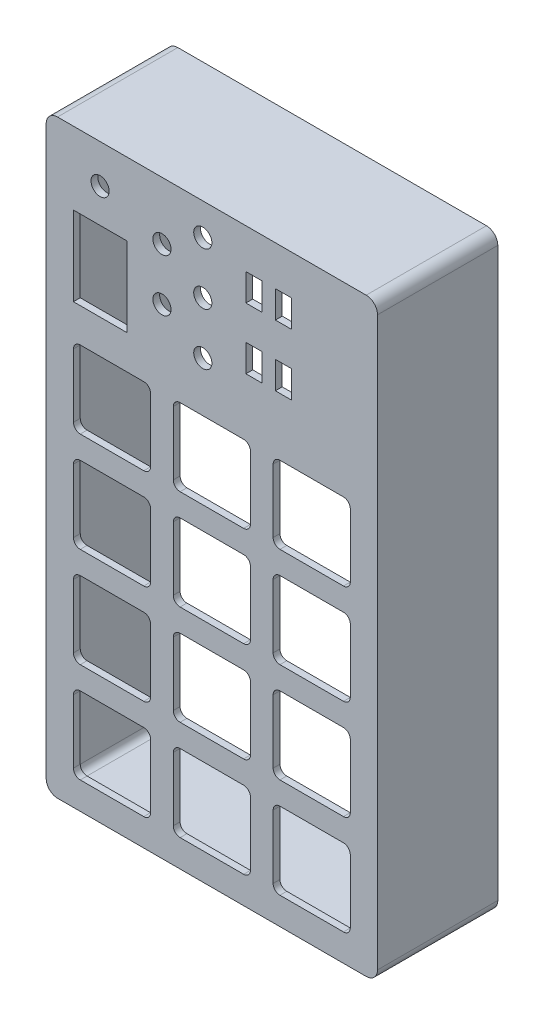
from build123d import *

# Parameters (mm, degrees)
CROQUIS1_W              = 12
CROQUIS1_H              = 7
CROQUIS1_R              = 4
CROQUIS1_W_2            = 35
CROQUIS1_H_2            = 23.5
SALIENTE_EXTRUIR1_DEPTH = 3
SALIENTE_EXTRUIR2_START = -50
SALIENTE_EXTRUIR2_DEPTH = 50


with BuildPart() as part:
    # Croquis1 → Saliente-Extruir1 (new body)
    with BuildSketch(Plane(origin=(0, 0, 0), x_dir=(0, 1, 0), z_dir=(0, 0, 1))):
        with BuildLine():
            Line((-188, 68), (-188, -68))
            ThreePointArc((-188, -68), (-186.535533906, -71.535533906), (-183, -73))
            Line((-183, -73), (67, -73))
            ThreePointArc((67, -73), (70.535533906, -71.535533906), (72, -68))
            Line((72, -68), (72, 68))
            ThreePointArc((72, 68), (70.535533906, 71.535533906), (67, 73))
            Line((67, 73), (-183, 73))
            ThreePointArc((-183, 73), (-186.535533906, 71.535533906), (-188, 68))
        make_face()
        with BuildLine():
            Line((-176, -58), (-176, -30))
            ThreePointArc((-176, -30), (-175.121320344, -27.878679656), (-173, -27))
            Line((-173, -27), (-145, -27))
            ThreePointArc((-145, -27), (-142.878679656, -27.878679656), (-142, -30))
            Line((-142, -30), (-142, -58))
            ThreePointArc((-142, -58), (-142.878679656, -60.121320344), (-145, -61))
            Line((-145, -61), (-173, -61))
            ThreePointArc((-173, -61), (-175.121320344, -60.121320344), (-176, -58))
        make_face(mode=Mode.SUBTRACT)
        with BuildLine():
            Line((-132, -58), (-132, -30))
            ThreePointArc((-132, -30), (-131.121320344, -27.878679656), (-129, -27))
            Line((-129, -27), (-101, -27))
            ThreePointArc((-101, -27), (-98.878679656, -27.878679656), (-98, -30))
            Line((-98, -30), (-98, -58))
            ThreePointArc((-98, -58), (-98.878679656, -60.121320344), (-101, -61))
            Line((-101, -61), (-129, -61))
            ThreePointArc((-129, -61), (-131.121320344, -60.121320344), (-132, -58))
        make_face(mode=Mode.SUBTRACT)
        with BuildLine():
            Line((-88, -58), (-88, -30))
            ThreePointArc((-88, -30), (-87.121320344, -27.878679656), (-85, -27))
            Line((-85, -27), (-57, -27))
            ThreePointArc((-57, -27), (-54.878679656, -27.878679656), (-54, -30))
            Line((-54, -30), (-54, -58))
            ThreePointArc((-54, -58), (-54.878679656, -60.121320344), (-57, -61))
            Line((-57, -61), (-85, -61))
            ThreePointArc((-85, -61), (-87.121320344, -60.121320344), (-88, -58))
        make_face(mode=Mode.SUBTRACT)
        with BuildLine():
            Line((-44, -58), (-44, -30))
            ThreePointArc((-44, -30), (-43.121320344, -27.878679656), (-41, -27))
            Line((-41, -27), (-13, -27))
            ThreePointArc((-13, -27), (-10.878679656, -27.878679656), (-10, -30))
            Line((-10, -30), (-10, -58))
            ThreePointArc((-10, -58), (-10.878679656, -60.121320344), (-13, -61))
            Line((-13, -61), (-41, -61))
            ThreePointArc((-41, -61), (-43.121320344, -60.121320344), (-44, -58))
        make_face(mode=Mode.SUBTRACT)
        with Locations((21.5, -31.5)):
            Rectangle(CROQUIS1_W, CROQUIS1_H, mode=Mode.SUBTRACT)
        with Locations((21.5, -18.5)):
            Rectangle(CROQUIS1_W, CROQUIS1_H, mode=Mode.SUBTRACT)
        with Locations((48.5, -31.5)):
            Rectangle(CROQUIS1_W, CROQUIS1_H, mode=Mode.SUBTRACT)
        with Locations((48.5, -18.5)):
            Rectangle(CROQUIS1_W, CROQUIS1_H, mode=Mode.SUBTRACT)
        with BuildLine():
            Line((-176, -14), (-176, 14))
            ThreePointArc((-176, 14), (-175.121320344, 16.121320344), (-173, 17))
            Line((-173, 17), (-145, 17))
            ThreePointArc((-145, 17), (-142.878679656, 16.121320344), (-142, 14))
            Line((-142, 14), (-142, -14))
            ThreePointArc((-142, -14), (-142.878679656, -16.121320344), (-145, -17))
            Line((-145, -17), (-173, -17))
            ThreePointArc((-173, -17), (-175.121320344, -16.121320344), (-176, -14))
        make_face(mode=Mode.SUBTRACT)
        with BuildLine():
            Line((-132, -14), (-132, 14))
            ThreePointArc((-132, 14), (-131.121320344, 16.121320344), (-129, 17))
            Line((-129, 17), (-101, 17))
            ThreePointArc((-101, 17), (-98.878679656, 16.121320344), (-98, 14))
            Line((-98, 14), (-98, -14))
            ThreePointArc((-98, -14), (-98.878679656, -16.121320344), (-101, -17))
            Line((-101, -17), (-129, -17))
            ThreePointArc((-129, -17), (-131.121320344, -16.121320344), (-132, -14))
        make_face(mode=Mode.SUBTRACT)
        with BuildLine():
            Line((-88, -14), (-88, 14))
            ThreePointArc((-88, 14), (-87.121320344, 16.121320344), (-85, 17))
            Line((-85, 17), (-57, 17))
            ThreePointArc((-57, 17), (-54.878679656, 16.121320344), (-54, 14))
            Line((-54, 14), (-54, -14))
            ThreePointArc((-54, -14), (-54.878679656, -16.121320344), (-57, -17))
            Line((-57, -17), (-85, -17))
            ThreePointArc((-85, -17), (-87.121320344, -16.121320344), (-88, -14))
        make_face(mode=Mode.SUBTRACT)
        with BuildLine():
            ThreePointArc((-176, 58), (-175.121320344, 60.121320344), (-173, 61))
            Line((-173, 61), (-145, 61))
            ThreePointArc((-145, 61), (-142.878679656, 60.121320344), (-142, 58))
            Line((-142, 58), (-142, 30))
            ThreePointArc((-142, 30), (-142.878679656, 27.878679656), (-145, 27))
            Line((-145, 27), (-173, 27))
            ThreePointArc((-173, 27), (-175.121320344, 27.878679656), (-176, 30))
            Line((-176, 30), (-176, 58))
        make_face(mode=Mode.SUBTRACT)
        with BuildLine():
            Line((-132, 30), (-132, 58))
            ThreePointArc((-132, 58), (-131.121320344, 60.121320344), (-129, 61))
            Line((-129, 61), (-101, 61))
            ThreePointArc((-101, 61), (-98.878679656, 60.121320344), (-98, 58))
            Line((-98, 58), (-98, 30))
            ThreePointArc((-98, 30), (-98.878679656, 27.878679656), (-101, 27))
            Line((-101, 27), (-129, 27))
            ThreePointArc((-129, 27), (-131.121320344, 27.878679656), (-132, 30))
        make_face(mode=Mode.SUBTRACT)
        with BuildLine():
            Line((-88, 30), (-88, 58))
            ThreePointArc((-88, 58), (-87.121320344, 60.121320344), (-85, 61))
            Line((-85, 61), (-57, 61))
            ThreePointArc((-57, 61), (-54.878679656, 60.121320344), (-54, 58))
            Line((-54, 58), (-54, 30))
            ThreePointArc((-54, 30), (-54.878679656, 27.878679656), (-57, 27))
            Line((-57, 27), (-85, 27))
            ThreePointArc((-85, 27), (-87.121320344, 27.878679656), (-88, 30))
        make_face(mode=Mode.SUBTRACT)
        with BuildLine():
            Line((-44, -14), (-44, 14))
            ThreePointArc((-44, 14), (-43.121320344, 16.121320344), (-41, 17))
            Line((-41, 17), (-13, 17))
            ThreePointArc((-13, 17), (-10.878679656, 16.121320344), (-10, 14))
            Line((-10, 14), (-10, -14))
            ThreePointArc((-10, -14), (-10.878679656, -16.121320344), (-13, -17))
            Line((-13, -17), (-41, -17))
            ThreePointArc((-41, -17), (-43.121320344, -16.121320344), (-44, -14))
        make_face(mode=Mode.SUBTRACT)
        with Locations((12, 4)):
            Circle(CROQUIS1_R, mode=Mode.SUBTRACT)
        with Locations((35, 4)):
            Circle(CROQUIS1_R, mode=Mode.SUBTRACT)
        with Locations((58, 4)):
            Circle(CROQUIS1_R, mode=Mode.SUBTRACT)
        with Locations((23.5, 22)):
            Circle(CROQUIS1_R, mode=Mode.SUBTRACT)
        with Locations((46.5, 22)):
            Circle(CROQUIS1_R, mode=Mode.SUBTRACT)
        with BuildLine():
            Line((-44, 30), (-44, 58))
            ThreePointArc((-44, 58), (-43.121320344, 60.121320344), (-41, 61))
            Line((-41, 61), (-13, 61))
            ThreePointArc((-13, 61), (-10.878679656, 60.121320344), (-10, 58))
            Line((-10, 58), (-10, 30))
            ThreePointArc((-10, 30), (-10.878679656, 27.878679656), (-13, 27))
            Line((-13, 27), (-41, 27))
            ThreePointArc((-41, 27), (-43.121320344, 27.878679656), (-44, 30))
        make_face(mode=Mode.SUBTRACT)
        with Locations((22.5, 49.25)):
            Rectangle(CROQUIS1_W_2, CROQUIS1_H_2, mode=Mode.SUBTRACT)
        with Locations((55, 49.25)):
            Circle(CROQUIS1_R, mode=Mode.SUBTRACT)
    extrude(amount=SALIENTE_EXTRUIR1_DEPTH)

    # Croquis1<3> → Saliente-Extruir2 (add)
    with BuildSketch(Plane(origin=(0, 0, 0), x_dir=(0, 1, 0), z_dir=(0, 0, 1)).offset(SALIENTE_EXTRUIR2_START)):
        with BuildLine():
            Line((-188, 68), (-188, -68))
            ThreePointArc((-188, -68), (-186.535533906, -71.535533906), (-183, -73))
            Line((-183, -73), (67, -73))
            ThreePointArc((67, -73), (70.535533906, -71.535533906), (72, -68))
            Line((72, -68), (72, 68))
            ThreePointArc((72, 68), (70.535533906, 71.535533906), (67, 73))
            Line((67, 73), (-183, 73))
            ThreePointArc((-183, 73), (-186.535533906, 71.535533906), (-188, 68))
        make_face()
        with BuildLine():
            Line((67, -71), (-183, -71))
            ThreePointArc((-183, -71), (-185.121320344, -70.121320344), (-186, -68))
            Line((-186, -68), (-186, 68))
            ThreePointArc((-186, 68), (-185.121320344, 70.121320344), (-183, 71))
            Line((-183, 71), (67, 71))
            ThreePointArc((67, 71), (69.121320344, 70.121320344), (70, 68))
            Line((70, 68), (70, -68))
            ThreePointArc((70, -68), (69.121320344, -70.121320344), (67, -71))
        make_face(mode=Mode.SUBTRACT)
    extrude(amount=SALIENTE_EXTRUIR2_DEPTH)


solid = part.part
